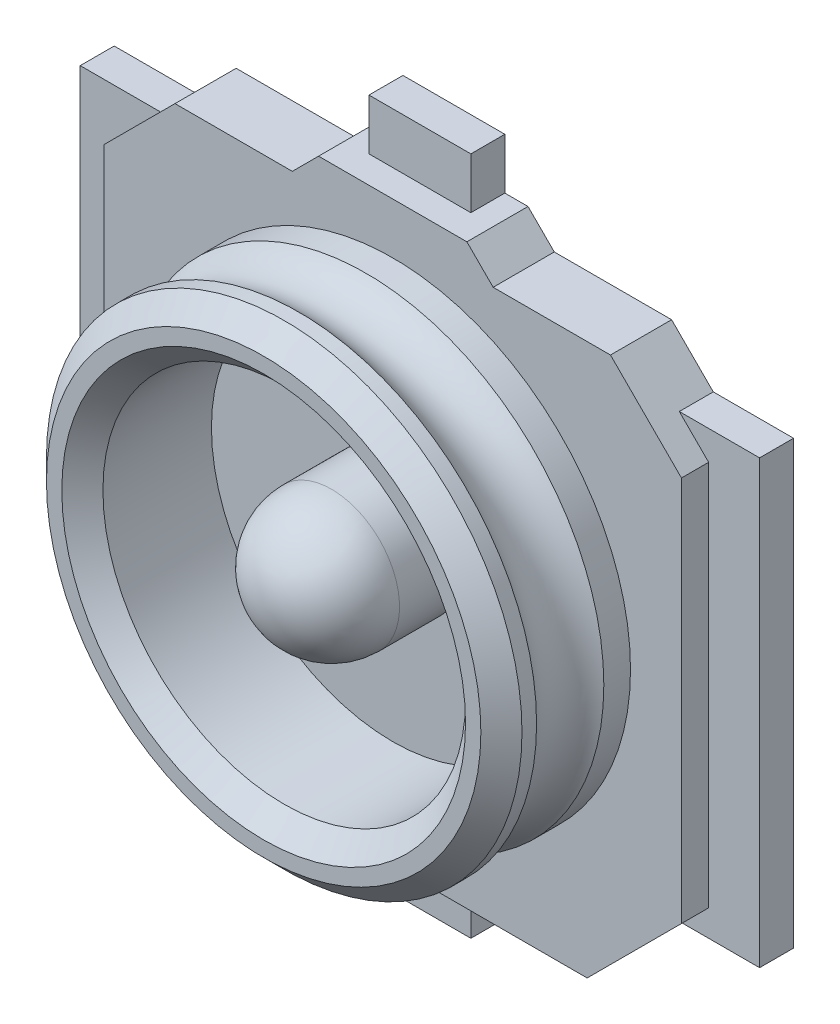
from build123d import *

# Parameters (mm, degrees)
BOSS_EXTRUDE1_DEPTH   = 0.1
SKETCH1_W             = 0.15
SKETCH1_H             = 0.3
BOSS_EXTRUDE1_2_DEPTH = 0.1
SKETCH1_W_2           = 0.3
SKETCH1_H_2           = 1.3
BOSS_EXTRUDE1_3_DEPTH = 0.1
BOSS_EXTRUDE2_DEPTH   = 0.18
SKETCH3_W             = 0.2
SKETCH3_H             = 0.38
FILLET1_R             = 0.2


with BuildPart() as part:
    # Sketch1 → Boss-Extrude1 (new body)
    with BuildSketch(Plane.XY):
        with BuildLine():
            Line((0, 1), (-0.15, 1))
            Line((-0.15, 1), (-0.15, 0.46269883))
            Line((-0.15, 0.46269883), (-0.075, 0.46269883))
            Line((-0.075, 0.46269883), (-0.075, 0.195574953))
            ThreePointArc((-0.075, 0.195574953), (-0.205961394, -0.038137467), (0, -0.209462556))
            Line((0, -0.209462556), (0, 1))
        make_face()
    boss_extrude1 = extrude(amount=BOSS_EXTRUDE1_DEPTH)



with BuildPart() as body_2:
    # Sketch1 → Boss-Extrude1 2 (new body)
    with BuildSketch(Plane.XY):
        with Locations((-0.075, -0.85)):
            Rectangle(SKETCH1_W, SKETCH1_H)
    boss_extrude1_2 = extrude(amount=BOSS_EXTRUDE1_2_DEPTH)


with BuildPart() as body_3:
    # Sketch1 → Boss-Extrude1 3 (new body)
    with BuildSketch(Plane.XY):
        with Locations((-0.85, 0)):
            Rectangle(SKETCH1_W_2, SKETCH1_H_2)
    boss_extrude1_3 = extrude(amount=BOSS_EXTRUDE1_3_DEPTH)


with BuildPart() as part_1:
    add(part.part)

    add(body_2.part)  # Boss-Extrude2 merges body 2

    add(body_3.part)  # Boss-Extrude2 merges body 3
    # Sketch2 → Boss-Extrude2 (add)
    with BuildSketch(Plane.XY):
        Polygon((0, -0.85), (0, 0.85), (-0.218303033, 0.85), (-0.295625525, 0.772677507), (-0.641012319, 0.772677507), (-0.85, 0.563689826), (-0.85, -0.572384616), (-0.572384616, -0.85), align=None)
    boss_extrude2 = extrude(amount=BOSS_EXTRUDE2_DEPTH)

    # Mirror2: Boss-Extrude1, Boss-Extrude1 2, Boss-Extrude1 3, Boss-Extrude2 across plane
    add(boss_extrude1.mirror(Plane(origin=(0, 0, 0), x_dir=(0, 0, 1), z_dir=(1, 0, 0))))
    add(boss_extrude1_2.mirror(Plane(origin=(0, 0, 0), x_dir=(0, 0, 1), z_dir=(1, 0, 0))))
    add(boss_extrude1_3.mirror(Plane(origin=(0, 0, 0), x_dir=(0, 0, 1), z_dir=(1, 0, 0))))
    add(boss_extrude2.mirror(Plane(origin=(0, 0, 0), x_dir=(0, 0, 1), z_dir=(1, 0, 0))))

    # Sketch3 → Revolve1 (revolve)
    with BuildSketch(Plane(origin=(0, 0, 0), x_dir=(1, 0, 0), z_dir=(0, 1, 0))):
        with Locations((0.1, -0.37)):
            Rectangle(SKETCH3_W, SKETCH3_H)
        with BuildLine():
            Line((0.533732411, -0.18), (0.533732411, -0.49946823))
            Line((0.533732411, -0.49946823), (0.594264181, -0.56))
            Line((0.594264181, -0.56), (0.63946823, -0.56))
            Line((0.63946823, -0.56), (0.7, -0.49946823))
            Line((0.7, -0.49946823), (0.7, -0.456485922))
            ThreePointArc((0.7, -0.456485922), (0.652125774, -0.357515968), (0.7, -0.258546013))
            Line((0.7, -0.258546013), (0.7, -0.18))
            Line((0.7, -0.18), (0.533732411, -0.18))
        make_face()
    revolve(axis=Axis((0, 0, 0.18), (0, 0, 1)))

    # Fillet1
    fillet1_edges = [part_1.edges().sort_by_distance(p)[0] for p in [
        (-0.2, 0, 0.56),
    ]]
    fillet(fillet1_edges, radius=FILLET1_R)


solid = part_1.part
